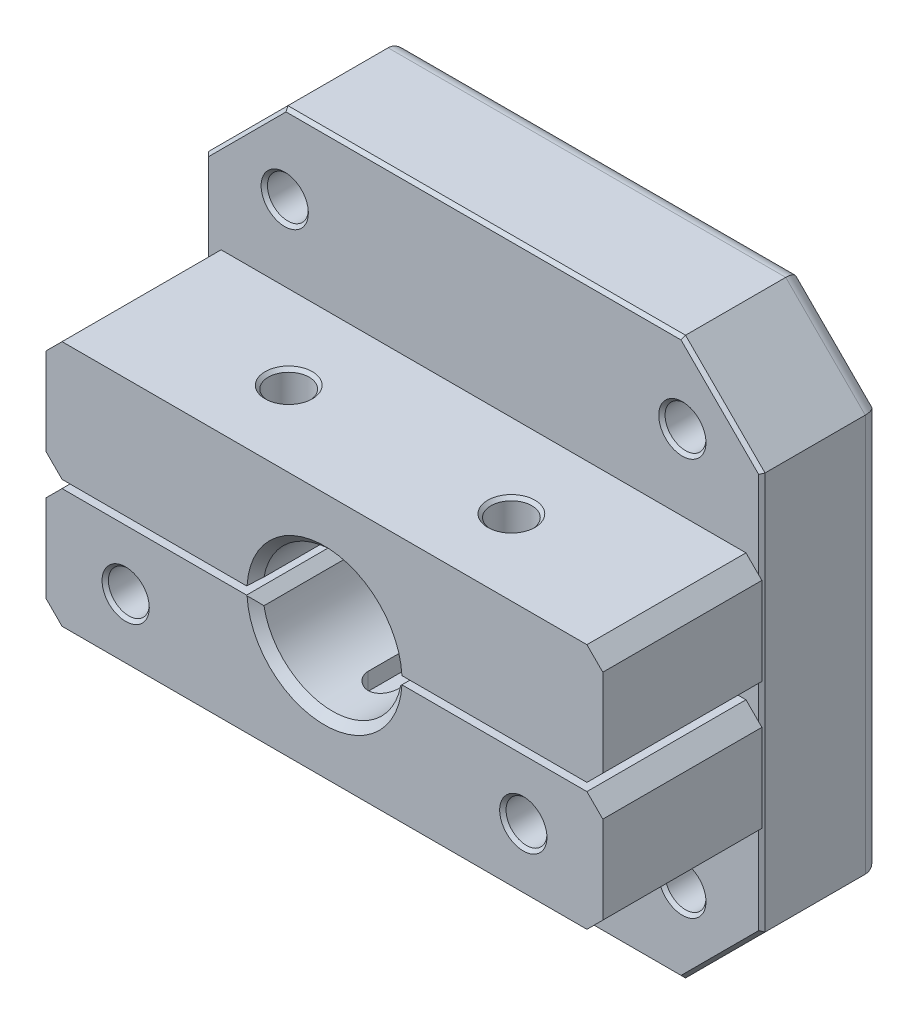
from build123d import *

# Parameters (mm, degrees)
SKETCH1_W               = 88.9
SKETCH1_H               = 88.9
SKETCH1_R               = 11.1125
SKETCH1_R_2             = 3.2639
BOSS_EXTRUDE1_DEPTH     = 9.525
BOSS_EXTRUDE2_START     = 9.525
SKETCH1_3_R             = 3.2639
BOSS_EXTRUDE2_DEPTH     = 25.4
CUT_EXTRUDE2_DEPTH      = 27.94
CUT_EXTRUDE3_DEPTH      = 9.525
BOSS_EXTRUDE3_START     = 34.925
BOSS_EXTRUDE3_DEPTH     = 25.4
CUT_EXTRUDE1_DEPTH      = 72.912172996
CUT_EXTRUDE1_DEPTH_BACK = 72.912172996
SKETCH2_R               = 3.2639
BOSS_EXTRUDE4_START     = -9.525
SKETCH1_5_W             = 88.9
SKETCH1_5_H             = 88.9
SKETCH1_5_R             = 3.2639
SKETCH1_5_R_2           = 4.8133
BOSS_EXTRUDE4_DEPTH     = 9.525
CHAMFER1_SIZE           = 12.7
CHAMFER2_SIZE           = 2.54
CHAMFER3_SIZE           = 2.54
CHAMFER4_SIZE           = 1.349308072
CHAMFER4_SIZE_2         = 1.27
CHAMFER5_SIZE           = 1.349308072
CHAMFER5_SIZE_2         = 1.27
CHAMFER6_SIZE           = 0.508
CHAMFER7_SIZE           = 0.508
CHAMFER8_SIZE           = 0.508
FILLET1_R               = 2.413
SKETCH3_R               = 11.1379
CUT_EXTRUDE4_DEPTH      = 9.525
FILLET2_R               = 2.54


# Some blends are built 0.0001 mm under size
with BuildPart() as part:
    # Sketch1 → Boss-Extrude1 (new body)
    with BuildSketch(Plane.XY):
        Rectangle(SKETCH1_W, SKETCH1_H)
        with Locations(Location((0, 0, 0), (0, 0, 180))):
            Circle(SKETCH1_R, mode=Mode.SUBTRACT)
        with Locations(Location((-31.75, 31.75, 0), (0, 0, 180))):
            Circle(SKETCH1_R_2, mode=Mode.SUBTRACT)
        with Locations(Location((31.75, 31.75, 0), (0, 0, 180))):
            Circle(SKETCH1_R_2, mode=Mode.SUBTRACT)
        with Locations(Location((31.75, -10.16, 0), (0, 0, 180))):
            Circle(SKETCH1_R_2, mode=Mode.SUBTRACT)
        with Locations(Location((-31.75, -10.16, 0), (0, 0, 180))):
            Circle(SKETCH1_R_2, mode=Mode.SUBTRACT)
        with Locations(Location((31.75, -31.75, 0), (0, 0, 180))):
            Circle(SKETCH1_R_2, mode=Mode.SUBTRACT)
        with Locations(Location((-31.75, -31.75, 0), (0, 0, 180))):
            Circle(SKETCH1_R_2, mode=Mode.SUBTRACT)
    extrude(amount=BOSS_EXTRUDE1_DEPTH)


with BuildPart() as body_2:
    # Sketch1<3> → Boss-Extrude2 (new body)
    with BuildSketch(Plane.XY.offset(BOSS_EXTRUDE2_START)):
        with BuildLine():
            Line((44.45, -19.685), (44.45, -0.635))
            Line((44.45, -0.635), (11.094342308, -0.635))
            ThreePointArc((11.094342308, -0.635), (0, -11.1125), (-11.094342308, -0.635))
            Line((-11.094342308, -0.635), (-44.45, -0.635))
            Line((-44.45, -0.635), (-44.45, -19.685))
            Line((-44.45, -19.685), (44.45, -19.685))
        make_face()
        with Locations(Location((-31.75, -10.16, 0), (0, 0, 180))):
            Circle(SKETCH1_3_R, mode=Mode.SUBTRACT)
        with Locations(Location((31.75, -10.16, 0), (0, 0, 180))):
            Circle(SKETCH1_3_R, mode=Mode.SUBTRACT)
    extrude(amount=BOSS_EXTRUDE2_DEPTH)


with BuildPart() as cut_extrude2_tool:
    # Sketch1<6> → Cut-Extrude2 (new body)
    with BuildSketch(Plane.XY):
        with BuildLine():
            ThreePointArc((0, -11.1125), (-1.213761863, -11.046014593), (-2.413, -10.847353928))
            Line((-2.413, -10.847353928), (-2.413, -11.1125))
            Line((-2.413, -11.1125), (-2.413, -13.62075))
            Line((-2.413, -13.62075), (2.413, -13.62075))
            Line((2.413, -13.62075), (2.413, -11.1125))
            Line((2.413, -11.1125), (0, -11.1125))
        make_face()
        with BuildLine():
            Line((2.413, -11.1125), (2.413, -10.847353928))
            ThreePointArc((2.413, -10.847353928), (1.213761863, -11.046014593), (0, -11.1125))
            Line((0, -11.1125), (2.413, -11.1125))
        make_face()
    extrude(amount=CUT_EXTRUDE2_DEPTH)


with BuildPart() as part_1:
    add(part.part)

    # Cut-Extrude2: cut by cut_extrude2_tool
    add(cut_extrude2_tool.part, mode=Mode.SUBTRACT)

    # Sketch1<7> → Cut-Extrude3 (cut)
    with BuildSketch(Plane.XY):
        with BuildLine():
            Line((2.413, -13.62075), (-2.413, -13.62075))
            ThreePointArc((-2.413, -13.62075), (0, -16.03375), (2.413, -13.62075))
        make_face()
    extrude(amount=CUT_EXTRUDE3_DEPTH, mode=Mode.SUBTRACT)

    # Sketch1<5> → Boss-Extrude4 (add)
    with BuildSketch(Plane.XY.offset(BOSS_EXTRUDE4_START)):
        Rectangle(SKETCH1_5_W, SKETCH1_5_H)
        with Locations(Location((-31.75, 31.75, 0), (0, 0, 180))):
            Circle(SKETCH1_5_R, mode=Mode.SUBTRACT)
        with Locations(Location((31.75, 31.75, 0), (0, 0, 180))):
            Circle(SKETCH1_5_R, mode=Mode.SUBTRACT)
        Circle(SKETCH1_5_R_2, mode=Mode.SUBTRACT)
        with Locations(Location((31.75, -10.16, 0), (0, 0, 180))):
            Circle(SKETCH1_5_R, mode=Mode.SUBTRACT)
        with Locations(Location((-31.75, -10.16, 0), (0, 0, 180))):
            Circle(SKETCH1_5_R, mode=Mode.SUBTRACT)
        with Locations(Location((31.75, -31.75, 0), (0, 0, 180))):
            Circle(SKETCH1_5_R, mode=Mode.SUBTRACT)
        with Locations(Location((-31.75, -31.75, 0), (0, 0, 180))):
            Circle(SKETCH1_5_R, mode=Mode.SUBTRACT)
    extrude(amount=BOSS_EXTRUDE4_DEPTH)

    # Chamfer1
    chamfer1_edges = [part_1.edges().sort_by_distance(p)[0] for p in [
        (-44.45, -44.45, 0),
        (-44.45, 44.45, 0),
        (44.45, 44.45, 0),
        (44.45, -44.45, 0),
    ]]
    chamfer(chamfer1_edges, length=CHAMFER1_SIZE)

    # Chamfer6
    chamfer6_edges = [part_1.edges().sort_by_distance(p)[0] for p in [
        (0, -44.45, 9.525),
        (-44.45, 0, 9.525),
        (44.45, 0, 9.525),
        (0, 44.45, 9.525),
        (-38.1, 38.1, 9.525),
        (38.1, 38.1, 9.525),
        (38.1, -38.1, 9.525),
        (-38.1, -38.1, 9.525),
        (35.0139, 31.75, 9.525),
        (-28.4861, 31.75, 9.525),
        (-28.4861, -31.75, 9.525),
        (35.0139, -31.75, 9.525),
    ]]
    chamfer(chamfer6_edges, length=CHAMFER6_SIZE)

    # Sketch3 → Cut-Extrude4 (cut)
    with BuildSketch(Plane.XY):
        Circle(SKETCH3_R)
    extrude(amount=CUT_EXTRUDE4_DEPTH, mode=Mode.SUBTRACT)

    # Fillet2
    fillet2_edges = [part_1.edges().sort_by_distance(p)[0] for p in [
        (0, -44.45, -9.525),
        (0, 44.45, -9.525),
        (44.45, 0, -9.525),
        (-44.45, 0, -9.525),
        (-38.1, 38.1, -9.525),
        (38.1, 38.1, -9.525),
        (38.1, -38.1, -9.525),
        (-38.1, -38.1, -9.525),
    ]]
    fillet(fillet2_edges, radius=FILLET2_R)


with BuildPart() as body_2_1:
    add(body_2.part)

    # Cut-Extrude2: cut by cut_extrude2_tool
    add(cut_extrude2_tool.part, mode=Mode.SUBTRACT)


with BuildPart() as body_3:
    # Sketch1<4> → Boss-Extrude3 (new body)
    with BuildSketch(Plane.XY.offset(BOSS_EXTRUDE3_START)):
        with BuildLine():
            Line((44.45, 19.685), (-44.45, 19.685))
            Line((-44.45, 19.685), (-44.45, 0.635))
            Line((-44.45, 0.635), (-11.094342308, 0.635))
            ThreePointArc((-11.094342308, 0.635), (0, 11.1125), (11.094342308, 0.635))
            Line((11.094342308, 0.635), (44.45, 0.635))
            Line((44.45, 0.635), (44.45, 19.685))
        make_face()
    extrude(amount=-BOSS_EXTRUDE3_DEPTH)


with BuildPart() as cut_extrude1_tool:
    # Sketch2 → Cut-Extrude1 (new, two sides: drawn at the far end of the back side and taken through both)
    with BuildSketch(Plane(origin=(0, 0, 0), x_dir=(1, 0, 0), z_dir=(0, 1, 0)).offset(-CUT_EXTRUDE1_DEPTH_BACK)):
        with Locations((17.78, -22.86)):
            Circle(SKETCH2_R)
        with Locations(Location((-17.78, -22.86, 0), (0, 0, 270))):
            Circle(SKETCH2_R)
    extrude(amount=CUT_EXTRUDE1_DEPTH + CUT_EXTRUDE1_DEPTH_BACK)


with BuildPart() as body_2_2:
    add(body_2_1.part)

    # Cut-Extrude1: cut by cut_extrude1_tool
    add(cut_extrude1_tool.part, mode=Mode.SUBTRACT)

    # Chamfer2
    chamfer2_edges = [body_2_2.edges().sort_by_distance(p)[0] for p in [
        (44.45, -19.685, 22.225),
        (-44.45, -19.685, 22.225),
        (-44.45, -0.635, 22.225),
        (44.45, -0.635, 22.225),
    ]]
    chamfer(chamfer2_edges, length=CHAMFER2_SIZE)

    # Chamfer4
    # the kernel refuses this chamfer: 1.349308072, 1.27 mm, written as the material it takes off along each edge
    with BuildSketch(Plane(origin=(-11.094342308, -0.635, 6.03492728), x_dir=(-1, 0, 0), z_dir=(0, 0, 1))) as chamfer4_piece_1:
        with BuildLine():
            Line((CHAMFER4_SIZE, 0), (-0.159787248, 1.345697321))
            ThreePointArc((-0.159787248, 1.345697321), (-0.061770998, 0.695423442), (0, 0))
            Line((0, 0), (CHAMFER4_SIZE, 0))
        make_face()
    extrude(amount=32.38014544, mode=Mode.SUBTRACT)
    with BuildSketch(Plane(origin=(11.094342308, -0.635, 5.767643516), x_dir=(1, 0, 0), z_dir=(0, 0, 1))) as chamfer4_piece_2:
        with BuildLine():
            Line((CHAMFER4_SIZE_2, 0), (-0.179005517, -1.449005517))
            ThreePointArc((-0.179005517, -1.449005517), (-0.068318427, -0.748637825), (0, 0))
            Line((0, 0), (CHAMFER4_SIZE_2, 0))
        make_face()
    extrude(amount=32.914712968, mode=Mode.SUBTRACT)
    # the kernel refuses this chamfer: 1.349308072, 1.27 mm, written as the material it takes off along each edge
    with BuildSketch(Plane(origin=(0, 0, 34.925), x_dir=(0.994427298828856, 0.10542460502152676, 0), z_dir=(-0.10542460502152676, 0.994427298828856, 0))) as chamfer4_2_piece_1:
        Polygon((11.1125 + CHAMFER4_SIZE_2, 0), (11.1125, CHAMFER4_SIZE_2), (11.1125, 0), align=None)
    revolve(axis=Axis((0, 0, 34.925), (0, 0, -1)), revolution_arc=192.645055692, mode=Mode.SUBTRACT)

    # Chamfer8
    chamfer8_edges = [body_2_2.edges().sort_by_distance(p)[0] for p in [
        (-28.4861, -10.16, 34.925),
        (35.0139, -10.16, 34.925),
        (-17.78, -0.635, 19.5961),
        (-17.78, -19.685, 19.5961),
        (14.5161, -0.635, 22.86),
        (14.5161, -19.685, 22.86),
    ]]
    chamfer(chamfer8_edges, length=CHAMFER8_SIZE)

    # Fillet1
    fillet1_edges = [body_2_2.edges().sort_by_distance(p)[0] for p in [
        (2.413, -12.234051964, 27.94),
        (-2.413, -12.234051964, 27.94),
    ]]
    fillet(fillet1_edges, radius=FILLET1_R - 0.0001)  # a hair under: the kernel refuses the full size


with BuildPart() as body_3_1:
    add(body_3.part)

    # Cut-Extrude1: cut by cut_extrude1_tool
    add(cut_extrude1_tool.part, mode=Mode.SUBTRACT)

    # Chamfer3
    chamfer3_edges = [body_3_1.edges().sort_by_distance(p)[0] for p in [
        (-44.45, 0.635, 22.225),
        (44.45, 0.635, 22.225),
        (44.45, 19.685, 22.225),
        (-44.45, 19.685, 22.225),
    ]]
    chamfer(chamfer3_edges, length=CHAMFER3_SIZE)

    # Chamfer5
    # the kernel refuses this chamfer: 1.349308072, 1.27 mm, written as the material it takes off along each edge
    with BuildSketch(Plane(origin=(-11.094342308, 0.635, 38.41507272), x_dir=(0.11791105976871363, 0.993024159818994, 0), z_dir=(0, 0, -1))) as chamfer5_piece_1:
        with BuildLine():
            Line((1.355150635, 0), (-CHAMFER5_SIZE * 0.117911059734, -CHAMFER5_SIZE * 0.993024159525))
            Line((-CHAMFER5_SIZE * 0.117911059734, -CHAMFER5_SIZE * 0.993024159525), (0, 0))
            ThreePointArc((0, 0), (0.697855763, -0.020658022), (1.355150635, 0))
        make_face()
    extrude(amount=32.38014544, mode=Mode.SUBTRACT)
    with BuildSketch(Plane(origin=(11.094342308, 0.635, 38.682356484), x_dir=(1, 0, 0), z_dir=(0, 0, -1))) as chamfer5_piece_2:
        with BuildLine():
            Line((CHAMFER5_SIZE_2, 0), (-0.179005517, -1.449005517))
            ThreePointArc((-0.179005517, -1.449005517), (-0.068318427, -0.748637825), (0, 0))
            Line((0, 0), (CHAMFER5_SIZE_2, 0))
        make_face()
    extrude(amount=32.914712968, mode=Mode.SUBTRACT)
    # the kernel refuses this chamfer: 1.349308072, 1.27 mm, written as the material it takes off along each edge
    with BuildSketch(Plane(origin=(0, 0, 34.925), x_dir=(-0.9933859481641617, -0.11482315964120433, 0), z_dir=(0.11482315964120433, -0.9933859481641617, 0))) as chamfer5_2_piece_1:
        Polygon((11.1125 + CHAMFER5_SIZE_2, 0), (11.1125, CHAMFER5_SIZE_2), (11.1125, 0), align=None)
    revolve(axis=Axis((0, 0, 34.925), (0, 0, -1)), revolution_arc=192.645055692, mode=Mode.SUBTRACT)

    # Chamfer7
    chamfer7_edges = [body_3_1.edges().sort_by_distance(p)[0] for p in [
        (-17.78, 19.685, 19.5961),
        (-17.78, 0.635, 19.5961),
        (14.5161, 19.685, 22.86),
        (14.5161, 0.635, 22.86),
    ]]
    chamfer(chamfer7_edges, length=CHAMFER7_SIZE)


solid = Compound([part_1.part, body_2_2.part, body_3_1.part])
